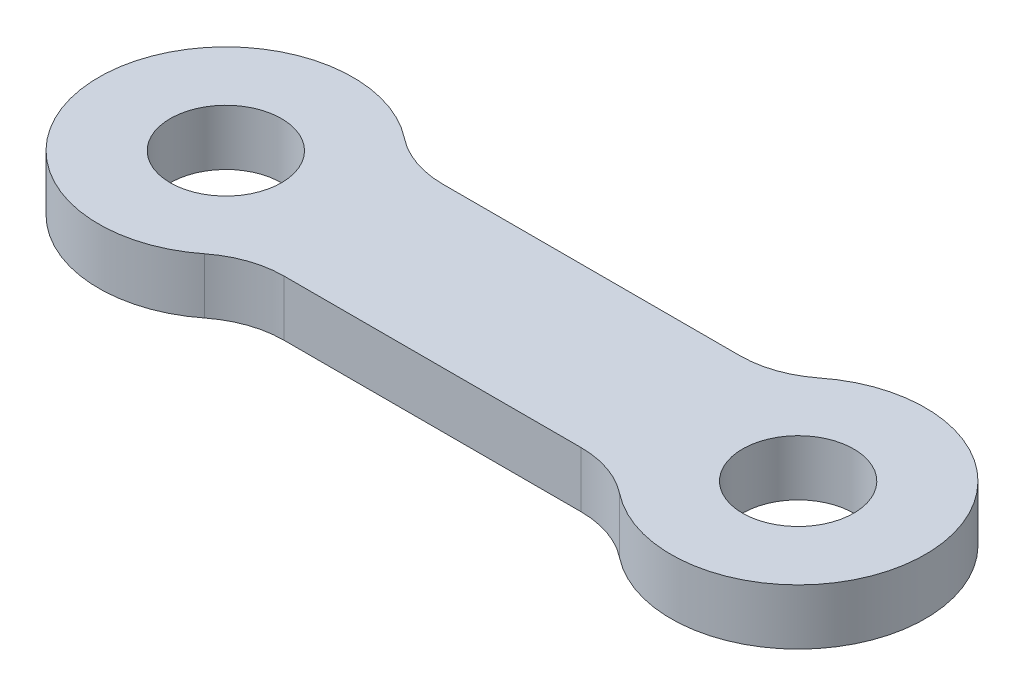
from build123d import *

# Parameters (mm, degrees)
SKETCH1_R           = 1.75
BOSS_EXTRUDE1_DEPTH = 1.75
FILLET1_R           = 3


with BuildPart() as part:
    # Sketch1 → Boss-Extrude1 (new body)
    with BuildSketch(Plane(origin=(0, 0, 0), x_dir=(1, 0, 0), z_dir=(0, 1, 0))):
        with BuildLine():
            ThreePointArc((3.122498999, 2.5), (-4, 0), (3.122498999, -2.5))
            Line((3.122498999, -2.5), (14.877501001, -2.5))
            ThreePointArc((14.877501001, -2.5), (22, 0), (14.877501001, 2.5))
            Line((14.877501001, 2.5), (3.122498999, 2.5))
        make_face()
        Circle(SKETCH1_R, mode=Mode.SUBTRACT)
        with Locations((18, 0)):
            Circle(SKETCH1_R, mode=Mode.SUBTRACT)
    extrude(amount=BOSS_EXTRUDE1_DEPTH)

    # Fillet1
    fillet1_edges = [part.edges().sort_by_distance(p)[0] for p in [
        (3.122498999, 0.875, 2.5),
        (14.877501001, 0.875, 2.5),
        (14.877501001, 0.875, -2.5),
        (3.122498999, 0.875, -2.5),
    ]]
    fillet(fillet1_edges, radius=FILLET1_R)


solid = part.part
